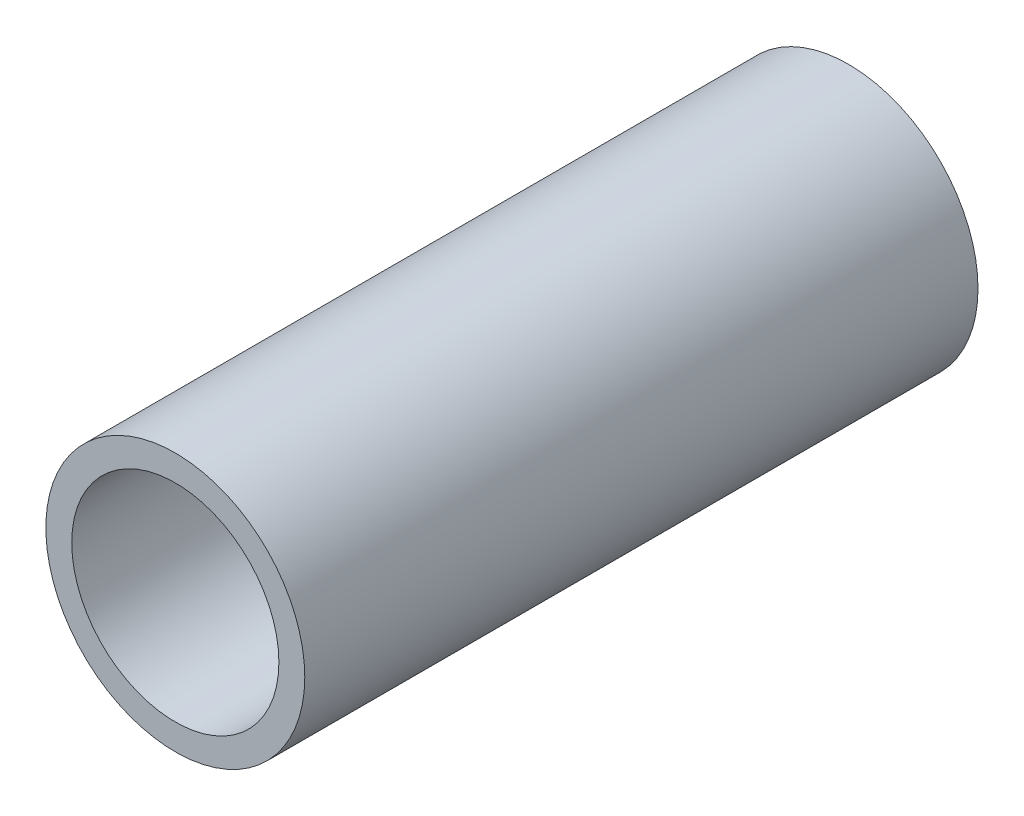
from build123d import *

# Parameters (mm, degrees)
SKETCH1_R           = 7.9375
SKETCH1_R_2         = 6.35
BOSS_EXTRUDE1_DEPTH = 20.6375


with BuildPart() as part:
    # Sketch1 → Boss-Extrude1 (new, symmetric)
    with BuildSketch(Plane.XY):
        Circle(SKETCH1_R)
        Circle(SKETCH1_R_2, mode=Mode.SUBTRACT)
    extrude(amount=BOSS_EXTRUDE1_DEPTH, both=True)


solid = part.part
